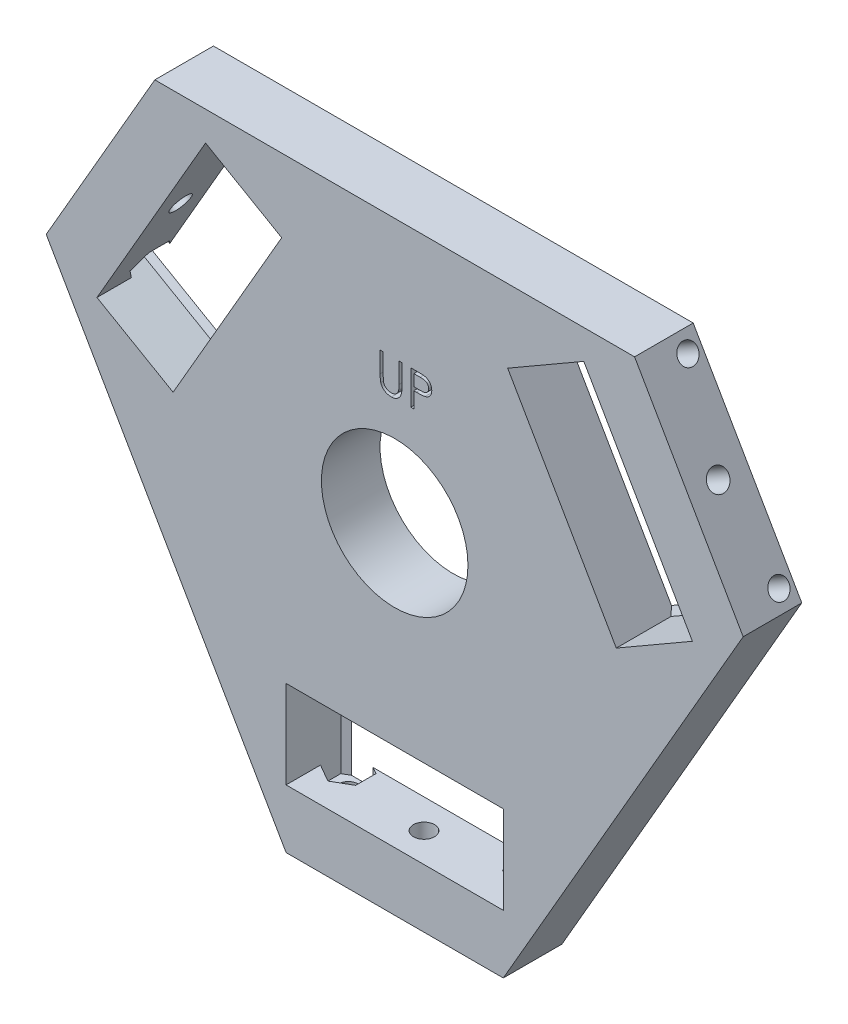
from build123d import *

# Parameters (mm, degrees)
ESBO_O1_R                = 12.5
RESSALTO_EXTRUS_O1_DEPTH = 10
ESBO_O2_R                = 1.7
ESBO_O2_R_2              = 1.8
CORTE_EXTRUS_O6_DEPTH    = 15
CORTE_EXTRUS_O7_START    = -10
CORTE_EXTRUS_O7_DEPTH    = 15
CORTE_EXTRUS_O8_START    = -10
CORTE_EXTRUS_O8_DEPTH    = 3
PADR_OCIRCULAR1_COUNT    = 3
CORTE_EXTRUS_O9_DEPTH    = 3


with BuildPart() as part:
    # Esboço1 → Ressalto-extrusão1 (new body)
    with BuildSketch(Plane.XY):
        Polygon((40.926406871, 45.024483083), (-40.926406871, 45.024483083), (-59.455549577, 12.931066495), (-18.529142706, -57.955549577), (18.529142706, -57.955549577), (59.455549577, 12.931066495), align=None)
        Circle(ESBO_O1_R, mode=Mode.SUBTRACT)
    extrude(amount=RESSALTO_EXTRUS_O1_DEPTH)

    # Esboço2 → Corte-extrusão6 (cut)
    with BuildSketch(Plane.XZ.offset(57.955549577)):
        with Locations((-15.529142706, 2.4)):
            Circle(ESBO_O2_R)
        with Locations((15.529142706, 2.4)):
            Circle(ESBO_O2_R)
        with Locations((0, 5)):
            Circle(ESBO_O2_R_2)
    corte_extrus_o6 = extrude(amount=-CORTE_EXTRUS_O6_DEPTH, mode=Mode.SUBTRACT)

    # Esboço2<3> → Corte-extrusão7 (cut)
    with BuildSketch(Plane.XZ.offset(57.955549577).offset(CORTE_EXTRUS_O7_START)):
        Polygon((-18.529142706, 0.667949192), (-17.372220768, 0), (17.372220768, 0), (18.529142706, 0.667949192), (18.529142706, 10), (-18.529142706, 10), align=None)
    corte_extrus_o7 = extrude(amount=-CORTE_EXTRUS_O7_DEPTH, mode=Mode.SUBTRACT)

    # Esboço2<4> → Corte-extrusão8 (cut)
    with BuildSketch(Plane.XZ.offset(57.955549577).offset(CORTE_EXTRUS_O8_START)):
        Polygon((-18.529142706, 0.667949192), (-17.372220768, 0), (-13.686064644, 0), (-12.529142706, 0.667949192), (-12.529142706, 4.132050808), (-15.529142706, 5.864101615), (-18.529142706, 4.132050808), align=None)
        Polygon((12.529142706, 0.667949192), (13.686064644, 0), (17.372220768, 0), (18.529142706, 0.667949192), (18.529142706, 4.132050808), (15.529142706, 5.864101615), (12.529142706, 4.132050808), align=None)
    corte_extrus_o8 = extrude(amount=CORTE_EXTRUS_O8_DEPTH, mode=Mode.SUBTRACT)

    # PadrãoCircular1: Corte-extrusão6, Corte-extrusão7, Corte-extrusão8 ×3 about axis
    padr_ocircular1_axis = Axis((0, 0, 10), (0, 0, 1))
    add([corte_extrus_o6.rotate(padr_ocircular1_axis, i * 360 / PADR_OCIRCULAR1_COUNT) for i in range(1, PADR_OCIRCULAR1_COUNT)], mode=Mode.SUBTRACT)
    add([corte_extrus_o7.rotate(padr_ocircular1_axis, i * 360 / PADR_OCIRCULAR1_COUNT) for i in range(1, PADR_OCIRCULAR1_COUNT)], mode=Mode.SUBTRACT)
    add([corte_extrus_o8.rotate(padr_ocircular1_axis, i * 360 / PADR_OCIRCULAR1_COUNT) for i in range(1, PADR_OCIRCULAR1_COUNT)], mode=Mode.SUBTRACT)

    # Esboço3 → Corte-extrusão9 (cut)
    # profile 1 of 2: a face of its own
    with BuildSketch(Plane.XY.offset(10)):
        with BuildLine():
            Line((-2.480958063, 24.316960901), (-1.958575584, 24.316960901))
            Line((-1.958575584, 24.316960901), (-1.958575584, 20.829358237))
            add(Edge.make_bspline(
                [(-1.958575584, 20.829358237), (-1.958653324, 20.779996347), (-1.958800849, 20.686323653), (-1.957815442, 20.552996134), (-1.955055754, 20.434463247), (-1.953315891, 20.330268089), (-1.949445314, 20.240888782), (-1.946288681, 20.165841093), (-1.942229803, 20.105480377), (-1.937351749, 20.07025448), (-1.935254938, 20.055112777)],
                knots=[0, 0, 0, 0, 1.528628734, 2.90083645, 4.128790002, 5.200304208, 6.127813768, 6.898992206, 7.526736466, 8, 8, 8, 8], degree=3))
            add(Edge.make_bspline(
                [(-1.935254938, 20.055112777), (-1.926644331, 20.000485482), (-1.909908294, 19.894308943), (-1.867255925, 19.743119812), (-1.80768801, 19.606859994), (-1.737101187, 19.481277525), (-1.644079928, 19.36986784), (-1.532646667, 19.267235484), (-1.397640307, 19.177475233), (-1.247528324, 19.095400132), (-1.085733708, 19.029433323), (-0.920403305, 18.979551501), (-0.754022302, 18.94915195), (-0.642634561, 18.945631944), (-0.587321578, 18.943883978)],
                knots=[0, 0, 0, 0, 1.035780045, 2.013197591, 2.933192213, 3.817615948, 4.702609284, 5.640816605, 6.646850145, 7.73207398, 8.84249596, 9.914020372, 10.964143139, 12, 12, 12, 12], degree=3))
            add(Edge.make_bspline(
                [(-0.587321578, 18.943883978), (-0.539833988, 18.945669893), (-0.445133085, 18.949231409), (-0.304424533, 18.971286432), (-0.167385304, 19.011035349), (-0.033338698, 19.062324804), (0.092309785, 19.130091929), (0.209630247, 19.208375218), (0.314345267, 19.300196163), (0.409903389, 19.401811855), (0.493116253, 19.516465308), (0.565246592, 19.641660021), (0.624329596, 19.779280065), (0.653506149, 19.875996408), (0.668495229, 19.92568319)],
                knots=[0, 0, 0, 0, 0.994687771, 1.983630487, 2.973142513, 3.978332533, 4.983357753, 5.956394766, 6.925816176, 7.893390482, 8.871859704, 9.88551698, 10.913711441, 12, 12, 12, 12], degree=3))
            add(Edge.make_bspline(
                [(0.668495229, 19.92568319), (0.673484723, 19.946220045), (0.684603327, 19.991984435), (0.694992757, 20.069353772), (0.705813729, 20.160640012), (0.713321889, 20.266499038), (0.720641537, 20.386576132), (0.725020588, 20.521496825), (0.72704463, 20.670771199), (0.727647802, 20.774942764), (0.727962877, 20.829358237)],
                knots=[0, 0, 0, 0, 0.558680831, 1.244966039, 2.062412453, 2.990489873, 4.051219941, 5.244515665, 6.560634259, 8, 8, 8, 8], degree=3))
            Line((0.727962877, 20.829358237), (0.727962877, 24.316960901))
            Line((0.727962877, 24.316960901), (1.250345356, 24.316960901))
            Line((1.250345356, 24.316960901), (1.250345356, 20.801373461))
            add(Edge.make_bspline(
                [(1.250345356, 20.801373461), (1.249922729, 20.738012229), (1.249097948, 20.614358931), (1.24194568, 20.433162444), (1.230541836, 20.261276593), (1.214429623, 20.098678272), (1.193080464, 19.945949319), (1.169339413, 19.801751032), (1.139105118, 19.667118496), (1.10379195, 19.541001963), (1.063422728, 19.420950579), (1.011133104, 19.307014229), (0.952218786, 19.195729209), (0.882344417, 19.0887787), (0.803827392, 18.985689158), (0.714932156, 18.88708578), (0.61859876, 18.791392866), (0.513225778, 18.701065064), (0.400550202, 18.618228491), (0.280907201, 18.545388626), (0.155215835, 18.483814825), (0.023802829, 18.43313046), (-0.113387898, 18.395021299), (-0.256359804, 18.366623689), (-0.40543832, 18.350487844), (-0.506828349, 18.348089777), (-0.55817077, 18.346875431)],
                knots=[0, 0, 0, 0, 1.316592851, 2.569410997, 3.76748051, 4.895814652, 5.963796859, 6.97159953, 7.931736103, 8.829262218, 9.692595152, 10.560224239, 11.431080259, 12.30701507, 13.211635791, 14.121146779, 15.063487852, 16.031507147, 17.00238618, 17.966455255, 18.938106653, 19.907068911, 20.888905087, 21.893141452, 22.933117798, 24, 24, 24, 24], degree=3))
            add(Edge.make_bspline(
                [(-0.55817077, 18.346875431), (-0.614165694, 18.34818057), (-0.724027535, 18.350741249), (-0.885910011, 18.365414323), (-1.041100407, 18.393052295), (-1.191237788, 18.428243297), (-1.33427811, 18.476778631), (-1.472137803, 18.533487061), (-1.602455752, 18.603132933), (-1.727346103, 18.680622183), (-1.843471323, 18.767809349), (-1.950071408, 18.8628389), (-2.04732235, 18.964188552), (-2.133584932, 19.072955588), (-2.210288356, 19.188294082), (-2.276363484, 19.310530318), (-2.333097058, 19.43961697), (-2.362378456, 19.52934628), (-2.377181187, 19.574707462)],
                knots=[0, 0, 0, 0, 1.13879206, 2.234305948, 3.301075583, 4.341971843, 5.366689343, 6.369221514, 7.369726634, 8.367512178, 9.355451585, 10.318319045, 11.268648973, 12.207971039, 13.137398894, 14.081662264, 15.030215811, 16, 16, 16, 16], degree=3))
            add(Edge.make_bspline(
                [(-2.377181187, 19.574707462), (-2.385791294, 19.605695208), (-2.404466808, 19.672908319), (-2.424466023, 19.78414692), (-2.441278389, 19.912230062), (-2.457087037, 20.057166515), (-2.466415269, 20.219068614), (-2.474593437, 20.39786618), (-2.481015677, 20.593775409), (-2.480977805, 20.730239883), (-2.480958063, 20.801373461)],
                knots=[0, 0, 0, 0, 0.625038921, 1.35572334, 2.194682327, 3.136881307, 4.189498639, 5.346923369, 6.617055217, 8, 8, 8, 8], degree=3))
            Line((-2.480958063, 20.801373461), (-2.480958063, 24.316960901))
        make_face()
    # profile 2 of 2: a face of its own
    with BuildSketch(Plane.XY.offset(10)):
        with BuildLine():
            Line((2.742866723, 24.316960901), (3.884412363, 24.316960901))
            add(Edge.make_bspline(
                [(3.884412363, 24.316960901), (3.962928596, 24.316874593), (4.113369186, 24.316709222), (4.329097677, 24.311695413), (4.525026481, 24.30499864), (4.700733126, 24.29571542), (4.856758232, 24.284744662), (4.992395789, 24.26935764), (5.108711932, 24.253291648), (5.178406349, 24.236957714), (5.210191109, 24.229508477)],
                knots=[0, 0, 0, 0, 1.415646017, 2.712440637, 3.8905458, 4.950247383, 5.884950622, 6.709939814, 7.411656543, 8, 8, 8, 8], degree=3))
            add(Edge.make_bspline(
                [(5.210191109, 24.229508477), (5.25042726, 24.218495544), (5.329951447, 24.196729183), (5.444540444, 24.153133265), (5.553562732, 24.101440664), (5.657392359, 24.042527278), (5.754753419, 23.973865453), (5.847098513, 23.898238496), (5.933612695, 23.813900328), (6.013809462, 23.721796883), (6.087459298, 23.623474343), (6.150872592, 23.517464944), (6.203970611, 23.405553098), (6.249511599, 23.287816647), (6.282288636, 23.163266907), (6.306980444, 23.032769291), (6.322652835, 22.896337788), (6.324153881, 22.80310489), (6.324918005, 22.755643627)],
                knots=[0, 0, 0, 0, 0.999701418, 1.975846123, 2.934577507, 3.890451536, 4.834027766, 5.787354733, 6.749476667, 7.726910423, 8.712836071, 9.690891519, 10.682875813, 11.679750201, 12.712814741, 13.765529915, 14.8625177, 16, 16, 16, 16], degree=3))
            add(Edge.make_bspline(
                [(6.324918005, 22.755643627), (6.324217136, 22.707783443), (6.322845837, 22.614141762), (6.306387372, 22.47714797), (6.284217994, 22.34623179), (6.250129444, 22.221683502), (6.205482533, 22.10424275), (6.15310825, 21.99211482), (6.089938021, 21.887207318), (6.017352513, 21.789139386), (5.936606588, 21.697818972), (5.84804188, 21.613907844), (5.752015937, 21.537897176), (5.648833936, 21.469616566), (5.537489961, 21.410649397), (5.419672713, 21.357833974), (5.294358127, 21.31347746), (5.20764016, 21.290144132), (5.163549816, 21.278280679)],
                knots=[0, 0, 0, 0, 1.121902311, 2.195077645, 3.232258892, 4.234102512, 5.217864754, 6.176164875, 7.132989551, 8.084763148, 9.034132444, 9.988522005, 10.94243251, 11.903244335, 12.886203696, 13.894208494, 14.929344452, 16, 16, 16, 16], degree=3))
            add(Edge.make_bspline(
                [(5.163549816, 21.278280679), (5.127082571, 21.270525698), (5.047162484, 21.253530205), (4.9155406, 21.234556854), (4.762294047, 21.218362297), (4.587631994, 21.20621981), (4.391711217, 21.195824852), (4.174425733, 21.187562439), (3.935349012, 21.183022432), (3.768588384, 21.18278828), (3.68152274, 21.182666029)],
                knots=[0, 0, 0, 0, 0.601384939, 1.31797006, 2.144135048, 3.087295005, 4.142315834, 5.309527816, 6.595305764, 8, 8, 8, 8], degree=3))
            Line((3.68152274, 21.182666029), (3.265249202, 21.182666029))
            Line((3.265249202, 21.182666029), (3.265249202, 18.496127568))
            Line((3.265249202, 18.496127568), (2.742866723, 18.496127568))
            Line((2.742866723, 18.496127568), (2.742866723, 24.316960901))
        make_face()
        with BuildLine():
            Line((3.265249202, 23.719952354), (3.265249202, 21.779674576))
            Line((3.265249202, 21.779674576), (4.284361448, 21.766848221))
            add(Edge.make_bspline(
                [(4.284361448, 21.766848221), (4.334121134, 21.766822503), (4.430181183, 21.766772856), (4.568943568, 21.773400663), (4.697682585, 21.781051787), (4.81600279, 21.792254269), (4.923957519, 21.808089027), (5.021726778, 21.824074262), (5.108552462, 21.847200205), (5.210166253, 21.878338452), (5.323395344, 21.931445433), (5.446576731, 22.008529714), (5.550970195, 22.106786559), (5.641306695, 22.217262369), (5.712995876, 22.340163659), (5.765476496, 22.471662831), (5.796312207, 22.61041129), (5.800446984, 22.705354302), (5.802535527, 22.753311562)],
                knots=[0, 0, 0, 0, 1.160613943, 2.240541288, 3.23993089, 4.169200891, 5.011653406, 5.7853311, 6.478053781, 7.106038997, 8.262395093, 9.384106736, 10.481365981, 11.59014053, 12.70357646, 13.786202915, 14.881775077, 16, 16, 16, 16], degree=3))
            add(Edge.make_bspline(
                [(5.802535527, 22.753311562), (5.800435625, 22.80010859), (5.796261281, 22.893135289), (5.765234804, 23.029473775), (5.713097909, 23.159587203), (5.640825454, 23.280948394), (5.553111932, 23.391026678), (5.451165286, 23.486649877), (5.335225493, 23.56352097), (5.227376709, 23.613136559), (5.131580451, 23.643430297), (5.048372537, 23.66462618), (4.954423165, 23.681549183), (4.849701751, 23.69525226), (4.735019969, 23.706982838), (4.609392557, 23.714942374), (4.473295414, 23.719601463), (4.378814025, 23.719832558), (4.329836709, 23.719952354)],
                knots=[0, 0, 0, 0, 1.120700087, 2.227813068, 3.331159281, 4.466773991, 5.599788987, 6.693661531, 7.80175334, 8.91857717, 9.525282508, 10.207424825, 10.974604443, 11.810962634, 12.737642355, 13.736264703, 14.826523623, 16, 16, 16, 16], degree=3))
            Line((4.329836709, 23.719952354), (3.265249202, 23.719952354))
        make_face(mode=Mode.SUBTRACT)
    extrude(amount=-CORTE_EXTRUS_O9_DEPTH, mode=Mode.SUBTRACT)


solid = part.part
